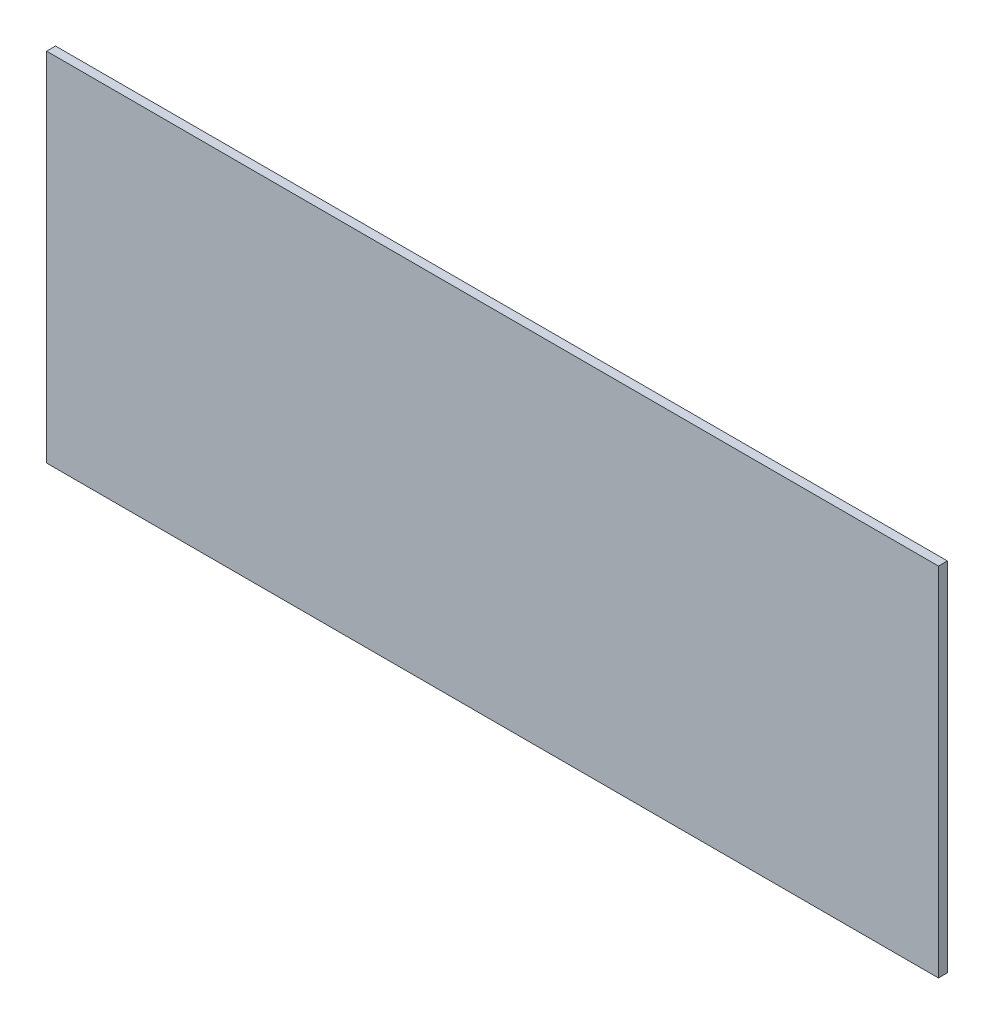
from build123d import *

# Parameters (mm, degrees)
SKIZZE1_W                       = 10000
SKIZZE1_H                       = 4000
AUFSATZ_LINEAR_AUSTRAGEN1_DEPTH = 100


with BuildPart() as part:
    # Skizze1 → Aufsatz-Linear austragen1 (new body)
    with BuildSketch(Plane.XY):
        with Locations((5000, 2000)):
            Rectangle(SKIZZE1_W, SKIZZE1_H)
    extrude(amount=AUFSATZ_LINEAR_AUSTRAGEN1_DEPTH)


solid = part.part
